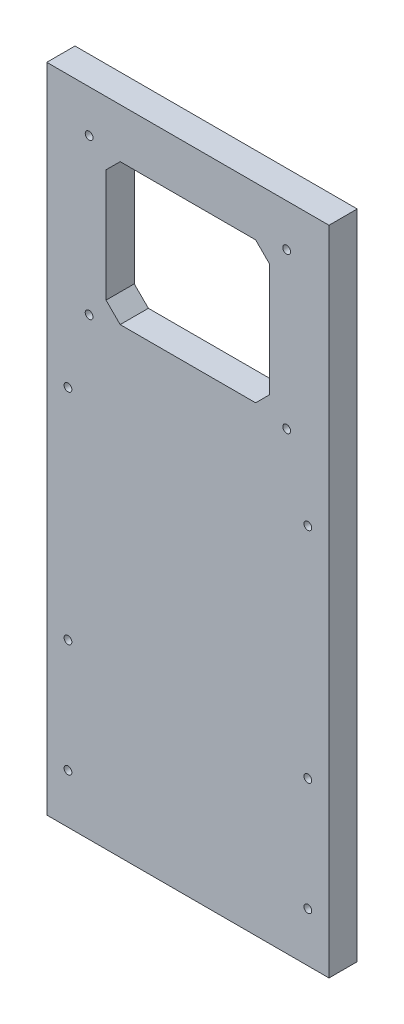
from build123d import *

# Parameters (mm, degrees)
SKETCH1_W           = 58
SKETCH1_H           = 50
SKETCH1_R           = 1.375
BOSS_EXTRUDE1_DEPTH = 10
CHAMFER1_SIZE       = 5


with BuildPart() as part:
    # Sketch1 → Boss-Extrude1 (new body)
    with BuildSketch(Plane.XY):
        Polygon((-50, 115.5), (-50, 100.5), (-50, -115.5), (-42.5, -115.5), (50, -115.5), (50, 115.5), align=None)
        with Locations((0, 73.01)):
            Rectangle(SKETCH1_W, SKETCH1_H, mode=Mode.SUBTRACT)
        with BuildLine():
            ThreePointArc((-42.5, -99.375), (-43.875, -98), (-42.5, -96.625))
            ThreePointArc((-42.5, -96.625), (-41.125, -98), (-42.5, -99.375))
        make_face(mode=Mode.SUBTRACT)
        with BuildLine():
            ThreePointArc((-42.5, -59.375), (-43.875, -58), (-42.5, -56.625))
            ThreePointArc((-42.5, -56.625), (-41.125, -58), (-42.5, -59.375))
        make_face(mode=Mode.SUBTRACT)
        with Locations((-42.5, 19.5)):
            Circle(SKETCH1_R, mode=Mode.SUBTRACT)
        with Locations((-35, 45.52)):
            Circle(SKETCH1_R, mode=Mode.SUBTRACT)
        with BuildLine():
            ThreePointArc((-35, 99.125), (-35.972271824, 99.527728176), (-36.375, 100.5))
            ThreePointArc((-36.375, 100.5), (-34.027728176, 101.472271824), (-35, 99.125))
        make_face(mode=Mode.SUBTRACT)
        with Locations((35, 45.52)):
            Circle(SKETCH1_R, mode=Mode.SUBTRACT)
        with Locations((35, 100.5)):
            Circle(SKETCH1_R, mode=Mode.SUBTRACT)
        with Locations((42.5, -98)):
            Circle(SKETCH1_R, mode=Mode.SUBTRACT)
        with Locations((42.5, -58)):
            Circle(SKETCH1_R, mode=Mode.SUBTRACT)
        with Locations((42.5, 19.5)):
            Circle(SKETCH1_R, mode=Mode.SUBTRACT)
    extrude(amount=BOSS_EXTRUDE1_DEPTH)

    # Chamfer1
    chamfer1_edges = [part.edges().sort_by_distance(p)[0] for p in [
        (-29, 48.01, 5),
        (29, 48.01, 5),
        (29, 98.01, 5),
        (-29, 98.01, 5),
    ]]
    chamfer(chamfer1_edges, length=CHAMFER1_SIZE)


solid = part.part
